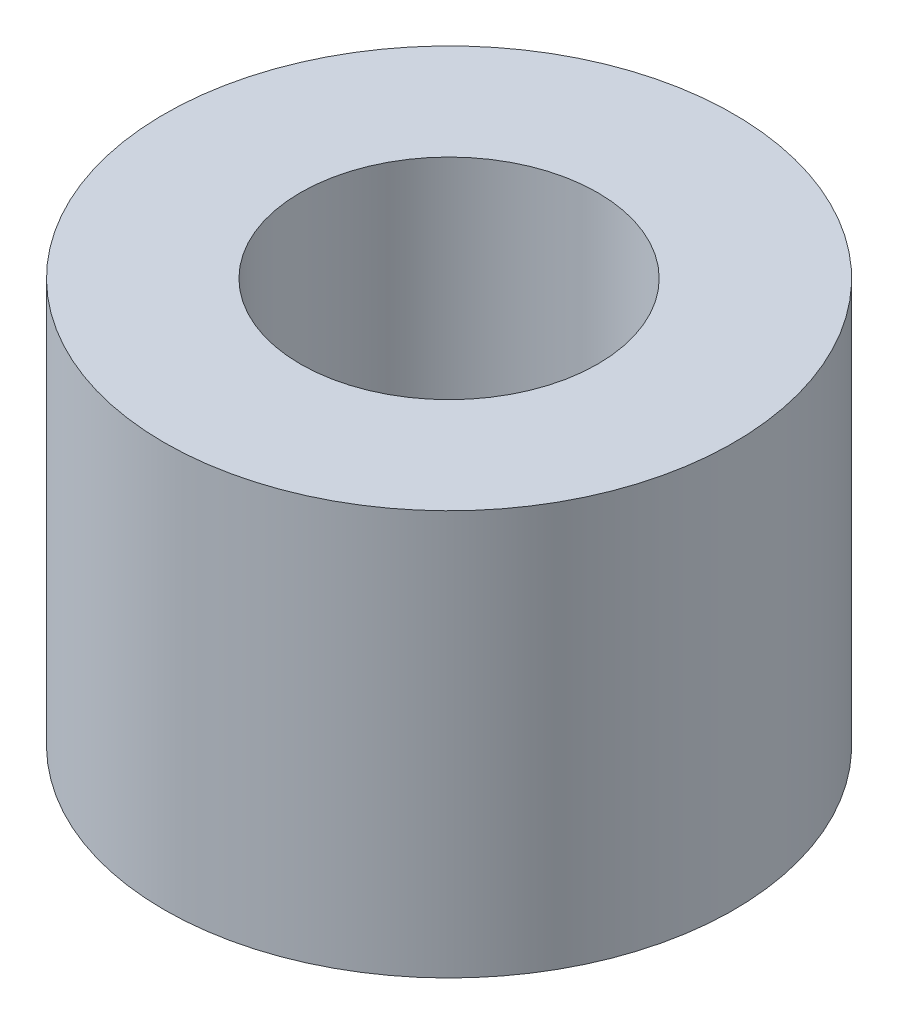
from build123d import *

# Parameters (mm, degrees)
SKETCH1_R           = 3.975
SKETCH1_R_2         = 2.075
BOSS_EXTRUDE1_DEPTH = 5.65


with BuildPart() as part:
    # Sketch1 → Boss-Extrude1 (new body)
    with BuildSketch(Plane(origin=(0, 0, 0), x_dir=(1, 0, 0), z_dir=(0, 1, 0))):
        Circle(SKETCH1_R)
        Circle(SKETCH1_R_2, mode=Mode.SUBTRACT)
    extrude(amount=BOSS_EXTRUDE1_DEPTH)


solid = part.part
